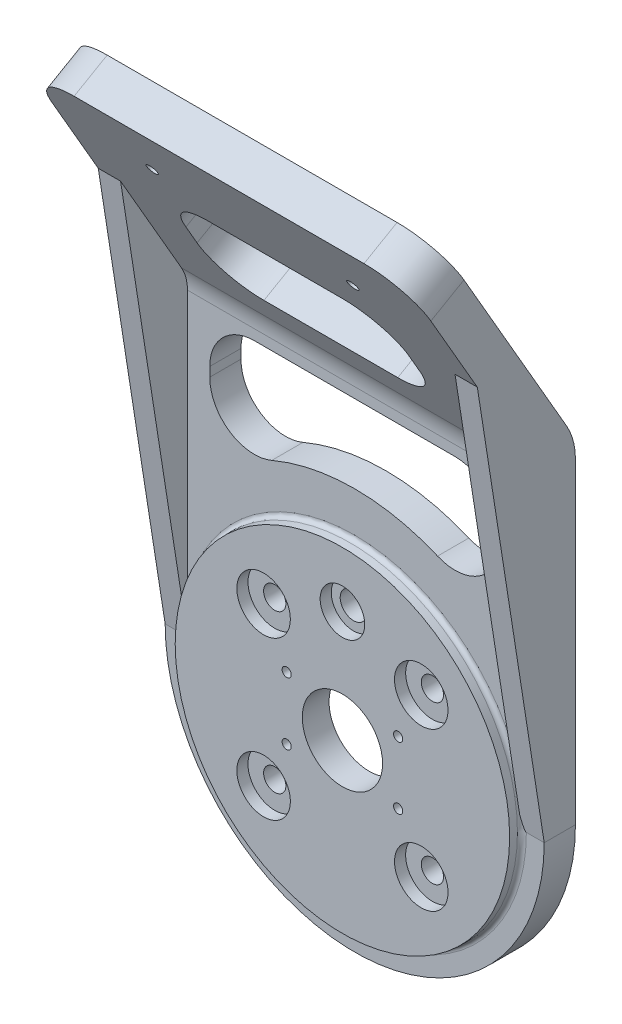
from build123d import *

# Parameters (mm, degrees)
SKETCH_1_R            = 37.5
EXTRUDE_1_DEPTH       = 12.5
SKETCH_2_R            = 31.6
CUT_EXTRUDE_1_DEPTH   = 6.5
CUT_EXTRUDE_2_REACH   = 56.486
SKETCH_3_R            = 2.5
SKETCH_4_R            = 6
CUT_EXTRUDE_3_DEPTH   = 2.5
CHAMFER_2_SIZE        = 1.1
SKETCH_14_R           = 1.025
CUT_EXTRUDE_4_DEPTH   = 6
SKETCH_15_R           = 2.5
CUT_EXTRUDE_5_DEPTH   = 3
SKETCH_17_R           = 9
CUT_EXTRUDE_7_DEPTH   = 6
SKETCH_18_R           = 3
CUT_EXTRUDE_8_DEPTH   = 6
SKETCH_19_R           = 5
CUT_EXTRUDE_9_DEPTH   = 2.5
SKETCH_24_R           = 42.5
SKETCH_24_R_2         = 37.5
EXTRUDE_2_DEPTH       = 3.5
EXTRUDE_START         = 40.640001537
EXTRUDE_3_OUTLINE_W   = 132.359796054
EXTRUDE_3_OUTLINE_H   = 7
EXTRUDE_3_DEPTH       = 34.359998463
EXTRUDE_START_2       = 2.75
EXTRUDE_3_2_DEPTH     = 7
EXTRUDE_START_3       = 26.556252313
EXTRUDE_3_3_OUTLINE_W = 132.359796054
EXTRUDE_3_3_OUTLINE_H = 60
EXTRUDE_3_3_DEPTH     = 8.562177827
EXTRUDE_3_4_OUTLINE_W = 132.359796054
EXTRUDE_3_4_OUTLINE_H = 0.830127019
EXTRUDE_3_4_DEPTH     = 2.5
CUT_EXTRUDE_11_DEPTH  = 47.359796
CUT_EXTRUDE_12_DEPTH  = 7
RIB_10_REACH          = 159.979
SKETCH_31_WALL_W      = 415.104412192
SKETCH_31_WALL_H      = 5
FILLET_6_R            = 10
FILLET_7_R            = 10
SKETCH_34_R           = 1.25
CUT_EXTRUDE_14_DEPTH  = 8.562177826
SKETCH_35_R           = 3
CUT_EXTRUDE_15_DEPTH  = 1.5
CUT_EXTRUDE_16_DEPTH  = 8.562177826
FILLET_9_R            = 1
FILLET_10_R           = 15
CHAMFER_3_SIZE        = 0.5
FILLET_11_R           = 10
FILLET_12_R           = 10


with BuildPart() as part:
    # 草图1 → 凸台-拉伸1 (new body)
    with BuildSketch(Plane.XY):
        Circle(SKETCH_1_R)
    extrude(amount=EXTRUDE_1_DEPTH)

    # 草图2 → 切除-拉伸1 (cut)
    with BuildSketch(Plane(origin=(0, 0, 0), x_dir=(-1, 0, 0), z_dir=(0, 0, -1))):
        Circle(SKETCH_2_R)
    extrude(amount=-CUT_EXTRUDE_1_DEPTH, mode=Mode.SUBTRACT)

    # 草图3 → 切除-拉伸2 (cut, up to next)
    with BuildSketch(Plane.XY.offset(12.5), mode=Mode.PRIVATE) as cut_extrude_2_sk1:
        with Locations((17.67766953, 17.67766953)):
            Circle(SKETCH_3_R)
    cut_extrude_2_tool1 = extrude(cut_extrude_2_sk1.sketch, amount=-CUT_EXTRUDE_2_REACH, mode=Mode.PRIVATE) & part.part
    # 草图3 → 切除-拉伸2 (cut, up to next)
    with BuildSketch(Plane.XY.offset(12.5), mode=Mode.PRIVATE) as cut_extrude_2_sk2:
        with Locations(Location((17.67766953, -17.67766953, 0), (0, 0, 180))):
            Circle(SKETCH_3_R)
    cut_extrude_2_tool2 = extrude(cut_extrude_2_sk2.sketch, amount=-CUT_EXTRUDE_2_REACH, mode=Mode.PRIVATE) & part.part
    # 草图3 → 切除-拉伸2 (cut, up to next)
    with BuildSketch(Plane.XY.offset(12.5), mode=Mode.PRIVATE) as cut_extrude_2_sk3:
        with Locations((-17.67766953, -17.67766953)):
            Circle(SKETCH_3_R)
    cut_extrude_2_tool3 = extrude(cut_extrude_2_sk3.sketch, amount=-CUT_EXTRUDE_2_REACH, mode=Mode.PRIVATE) & part.part
    # 草图3 → 切除-拉伸2 (cut, up to next)
    with BuildSketch(Plane.XY.offset(12.5), mode=Mode.PRIVATE) as cut_extrude_2_sk4:
        with Locations(Location((-17.67766953, 17.67766953, 0), (0, 0, 180))):
            Circle(SKETCH_3_R)
    cut_extrude_2_tool4 = extrude(cut_extrude_2_sk4.sketch, amount=-CUT_EXTRUDE_2_REACH, mode=Mode.PRIVATE) & part.part
    add(cut_extrude_2_tool1.solids().sort_by_distance((17.67767, 17.67767, 12.5))[0], mode=Mode.SUBTRACT)
    add(cut_extrude_2_tool2.solids().sort_by_distance((17.67767, -17.67767, 12.5))[0], mode=Mode.SUBTRACT)
    add(cut_extrude_2_tool3.solids().sort_by_distance((-17.67767, -17.67767, 12.5))[0], mode=Mode.SUBTRACT)
    add(cut_extrude_2_tool4.solids().sort_by_distance((-17.67767, 17.67767, 12.5))[0], mode=Mode.SUBTRACT)

    # 草图4 → 切除-拉伸3 (cut)
    with BuildSketch(Plane.XY.offset(12.5)):
        with Locations((-17.67766953, 17.67766953)):
            Circle(SKETCH_4_R)
        with Locations(Location((17.67766953, 17.67766953, 0), (0, 0, 180))):
            Circle(SKETCH_4_R)
        with Locations((17.67766953, -17.67766953)):
            Circle(SKETCH_4_R)
        with Locations(Location((-17.67766953, -17.67766953, 0), (0, 0, 180))):
            Circle(SKETCH_4_R)
    extrude(amount=-CUT_EXTRUDE_3_DEPTH, mode=Mode.SUBTRACT)

    # 倒角2
    chamfer_2_edges = [part.edges().sort_by_distance(p)[0] for p in [
        (31.6, 0, 0),
    ]]
    chamfer(chamfer_2_edges, length=CHAMFER_2_SIZE)

    # 草图14 → 切除-拉伸4 (cut)
    with BuildSketch(Plane(origin=(0, 0, 6.5), x_dir=(-1, 0, 0), z_dir=(0, 0, -1))):
        with Locations((12.5, 7)):
            Circle(SKETCH_14_R)
        with Locations(Location((12.5, -7, 0), (0, 0, 180))):
            Circle(SKETCH_14_R)
        with Locations((-12.5, -7)):
            Circle(SKETCH_14_R)
        with Locations(Location((-12.5, 7, 0), (0, 0, 180))):
            Circle(SKETCH_14_R)
    extrude(amount=-CUT_EXTRUDE_4_DEPTH, mode=Mode.SUBTRACT)

    # 草图15 → 切除-拉伸5 (cut)
    with BuildSketch(Plane(origin=(0, 0, 6.5), x_dir=(-1, 0, 0), z_dir=(0, 0, -1))):
        with Locations((12.5, 7)):
            Circle(SKETCH_15_R)
        with Locations((12.5, -7)):
            Circle(SKETCH_15_R)
        with Locations((-12.5, -7)):
            Circle(SKETCH_15_R)
        with Locations((-12.5, 7)):
            Circle(SKETCH_15_R)
    extrude(amount=-CUT_EXTRUDE_5_DEPTH, mode=Mode.SUBTRACT)

    # 草图17 → 切除-拉伸7 (cut)
    with BuildSketch(Plane.XY.offset(12.5)):
        Circle(SKETCH_17_R)
    extrude(amount=-CUT_EXTRUDE_7_DEPTH, mode=Mode.SUBTRACT)

    # 草图18 → 切除-拉伸8 (cut)
    with BuildSketch(Plane.XY.offset(12.5)):
        with Locations((0, 25)):
            Circle(SKETCH_18_R)
    extrude(amount=-CUT_EXTRUDE_8_DEPTH, mode=Mode.SUBTRACT)

    # 草图19 → 切除-拉伸9 (cut)
    with BuildSketch(Plane.XY.offset(12.5)):
        with Locations((0, 25)):
            Circle(SKETCH_19_R)
    extrude(amount=-CUT_EXTRUDE_9_DEPTH, mode=Mode.SUBTRACT)

    # 草图24 → 凸台-拉伸2 (add, symmetric)
    with BuildSketch(Plane(origin=(0, 0, 6.25), x_dir=(-1, 0, 0), z_dir=(0, 0, -1))):
        Circle(SKETCH_24_R)
        Circle(SKETCH_24_R_2, mode=Mode.SUBTRACT)
    extrude(amount=EXTRUDE_2_DEPTH, both=True)

    # 凸台-拉伸3: read off the stored shape, not the designer's step
    # 凸台-拉伸3 outline → 凸台-拉伸3 (add)
    with BuildSketch(Plane(origin=(0, 0, 0), x_dir=(1, 0, 0), z_dir=(0, 1, 0)).offset(EXTRUDE_START)):
        with Locations((-23.679898027, -6.25)):
            Rectangle(EXTRUDE_3_OUTLINE_W, EXTRUDE_3_OUTLINE_H)
    extrude(amount=EXTRUDE_3_DEPTH)

    # Extrude 3 2 outline → Extrude 3 2 (add)
    with BuildSketch(Plane.XY.offset(EXTRUDE_START_2)):
        with BuildLine():
            Line((-89.859796054, 40.640001537), (-89.859796054, 0))
            Line((-89.859796054, 0), (-42.5, 0))
            ThreePointArc((-42.5, 0), (-34.166916622, 25.275913604), (-12.435444305, 40.640001537))
            Line((-12.435444305, 40.640001537), (-89.859796054, 40.640001537))
        make_face()
        with BuildLine():
            ThreePointArc((12.435444305, 40.640001537), (34.166916622, 25.275913604), (42.5, 0))
            Line((42.5, 0), (42.5, 40.640001537))
            Line((42.5, 40.640001537), (12.435444305, 40.640001537))
        make_face()
    extrude(amount=EXTRUDE_3_2_DEPTH)

    # Extrude 3 3 outline → Extrude 3 3 (add)
    with BuildSketch(Plane(origin=(0, 0, 0), x_dir=(1, 0, 0), z_dir=(0, 0.500000000000001, -0.866025403784438)).offset(EXTRUDE_START_3)):
        with Locations((-23.679898027, -96.326905284)):
            Rectangle(EXTRUDE_3_3_OUTLINE_W, EXTRUDE_3_3_OUTLINE_H)
    extrude(amount=EXTRUDE_3_3_DEPTH)

    # Extrude 3 4 outline → Extrude 3 4 (add)
    with BuildSketch(Plane(origin=(0, 0, 0), x_dir=(1, 0, 0), z_dir=(0, 0.500000000000001, -0.866025403784438)).offset(EXTRUDE_START_3)):
        with Locations((-23.679898027, -65.911841775)):
            Rectangle(EXTRUDE_3_4_OUTLINE_W, EXTRUDE_3_4_OUTLINE_H)
    extrude(amount=EXTRUDE_3_4_DEPTH)

    # 草图26 → 切除-拉伸11 (cut)
    with BuildSketch(Plane.ZY.offset(89.859796054)):
        Polygon((9.75, 0), (9.75, 70), (40.165063509, 122.680435314), (32.75, 126.961524227), (2.75, 75), (2.75, 0), align=None)
    extrude(amount=-CUT_EXTRUDE_11_DEPTH, mode=Mode.SUBTRACT)

    # 草图27 → 切除-拉伸12 (cut)
    with BuildSketch(Plane(origin=(0, 0, 2.75), x_dir=(-1, 0, 0), z_dir=(0, 0, -1))):
        with BuildLine():
            Line((32.5, 34.641016151), (32.5, 65))
            Line((32.5, 65), (-32.5, 65))
            Line((-32.5, 65), (-32.5, 34.641016151))
            ThreePointArc((-32.5, 34.641016151), (0, 47.5), (32.5, 34.641016151))
        make_face()
    extrude(amount=-CUT_EXTRUDE_12_DEPTH, mode=Mode.SUBTRACT)

    # 草图31 wall → 筋10 (add, up to next)
    with BuildSketch(Plane(origin=(-42.5, 47.990381057, 17.25), x_dir=(0, -0.988007313769, -0.15440708513), z_dir=(0, -0.15440708513, 0.988007313769)), mode=Mode.PRIVATE) as rib_10_sk1:
        with Locations((0, 2.5)):
            Rectangle(SKETCH_31_WALL_W, SKETCH_31_WALL_H)
    rib_10_tool1 = extrude(rib_10_sk1.sketch, amount=-RIB_10_REACH, mode=Mode.PRIVATE) - part.part
    rib_10 = rib_10_tool1.solids().sort_by_distance((-42.5, 47.990381057, 17.25))[0]
    add(rib_10)

    # 镜向2: 筋10 across plane
    add(rib_10.mirror(Plane(origin=(0, 0, 0), x_dir=(0, 0, 1), z_dir=(1, 0, 0))))

    # 圆角6
    fillet_6_edges = [part.edges().sort_by_distance(p)[0] for p in [
        (0, 70, 9.75),
    ]]
    fillet(fillet_6_edges, radius=FILLET_6_R)

    # 圆角7
    fillet_7_edges = [part.edges().sort_by_distance(p)[0] for p in [
        (42.5, 124.820979771, 36.457531755),
        (-42.500000054, 124.82097977, 36.457531755),
    ]]
    fillet(fillet_7_edges, radius=FILLET_7_R)

    # 草图34 → 切除-拉伸14 (cut)
    with BuildSketch(Plane(origin=(0, 13.278126157, -22.998389132), x_dir=(1, 0, 0), z_dir=(0, -0.5000000000000017, 0.8660254037844378))):
        with Locations(Location((-22.5, 111.326905284, 0), (0, 0, 270))):
            Circle(SKETCH_34_R)
        with Locations(Location((22.5, 111.326905284, 0), (0, 0, 90))):
            Circle(SKETCH_34_R)
    extrude(amount=-CUT_EXTRUDE_14_DEPTH, mode=Mode.SUBTRACT)

    # 草图35 → 切除-拉伸15 (cut)
    with BuildSketch(Plane(origin=(0, 17.55921507, -30.413452642), x_dir=(-1, 0, 0), z_dir=(0, 0.5000000000000013, -0.8660254037844379))):
        with Locations(Location((-22.5, 111.326905284, 0), (0, 0, 90))):
            Circle(SKETCH_35_R)
        with Locations(Location((22.5, 111.326905284, 0), (0, 0, 90))):
            Circle(SKETCH_35_R)
    extrude(amount=-CUT_EXTRUDE_15_DEPTH, mode=Mode.SUBTRACT)

    # 草图36 → 切除-拉伸16 (cut)
    with BuildSketch(Plane(origin=(0, 13.278126157, -22.998389132), x_dir=(1, 0, 0), z_dir=(0, -0.5000000000000017, 0.8660254037844378))):
        with BuildLine():
            Line((-15, 76.176270189), (15, 76.176270189))
            ThreePointArc((15, 76.176270189), (22.071067812, 79.105202377), (25, 86.176270189))
            Line((25, 86.176270189), (25, 91.176270189))
            ThreePointArc((25, 91.176270189), (22.071067812, 98.247338001), (15, 101.176270189))
            Line((15, 101.176270189), (-15, 101.176270189))
            ThreePointArc((-15, 101.176270189), (-22.071067812, 98.247338001), (-25, 91.176270189))
            Line((-25, 91.176270189), (-25, 86.176270189))
            ThreePointArc((-25, 86.176270189), (-22.071067812, 79.105202377), (-15, 76.176270189))
        make_face()
    extrude(amount=-CUT_EXTRUDE_16_DEPTH, mode=Mode.SUBTRACT)

    # 圆角9
    # the kernel refuses this fillet: 1 mm, written as the material it adds along each edge
    with BuildSketch(Plane(origin=(0, 0, 9.75), x_dir=(-1.0, 3.747518651596283e-12, 0), z_dir=(-3.747518651596283e-12, -1.0, 0))) as fillet_9_piece_1:
        with BuildLine():
            CenterArc((37.5 + FILLET_9_R, -FILLET_9_R), FILLET_9_R, 90, 90)
            Line((37.5, -FILLET_9_R), (37.5, 0))
            Line((37.5, 0), (37.5 + FILLET_9_R, 0))
        make_face()
    revolve(axis=Axis((0, 0, 9.75), (0, 0, -1)), revolution_arc=180)
    with BuildSketch(Plane(origin=(0, 0, 2.75), x_dir=(1, 0, 0), z_dir=(0, 1, 0))) as fillet_9_piece_2:
        with BuildLine():
            CenterArc((37.5 + FILLET_9_R, FILLET_9_R), FILLET_9_R, 180, 90)
            Line((37.5, FILLET_9_R), (37.5, 0))
            Line((37.5, 0), (37.5 + FILLET_9_R, 0))
        make_face()
    revolve(axis=Axis((0, 0, 2.75), (0, 0, -1)))
    with BuildSketch(Plane(origin=(0, 0, 9.75), x_dir=(1, 0, 0), z_dir=(0, 1, 0))) as fillet_9_piece_3:
        with BuildLine():
            CenterArc((37.5 + FILLET_9_R, -FILLET_9_R), FILLET_9_R, 90, 90)
            Line((37.5, -FILLET_9_R), (37.5, 0))
            Line((37.5, 0), (37.5 + FILLET_9_R, 0))
        make_face()
    revolve(axis=Axis((0, 0, 9.75), (0, 0, -1)), revolution_arc=180)

    # 圆角10
    fillet_10_edges = [part.edges().sort_by_distance(p)[0] for p in [
        (-2.7e-08, 75, 2.75),
    ]]
    fillet(fillet_10_edges, radius=FILLET_10_R)

    # 倒角3
    chamfer_3_edges = [part.edges().sort_by_distance(p)[0] for p in [
        (22.5, 112.138611416, 25.924038106),
        (-22.5, 114.303674925, 27.174038106),
    ]]
    chamfer(chamfer_3_edges, length=CHAMFER_3_SIZE)

    # 圆角11
    fillet_11_edges = [part.edges().sort_by_distance(p)[0] for p in [
        (32.5, 65, 6.25),
        (-32.5, 65, 6.25),
    ]]
    fillet(fillet_11_edges, radius=FILLET_11_R)

    # 圆角12
    fillet_12_edges = [part.edges().sort_by_distance(p)[0] for p in [
        (-32.5, 34.641016151, 6.25),
        (32.5, 34.641016151, 6.25),
    ]]
    fillet(fillet_12_edges, radius=FILLET_12_R)


solid = part.part
